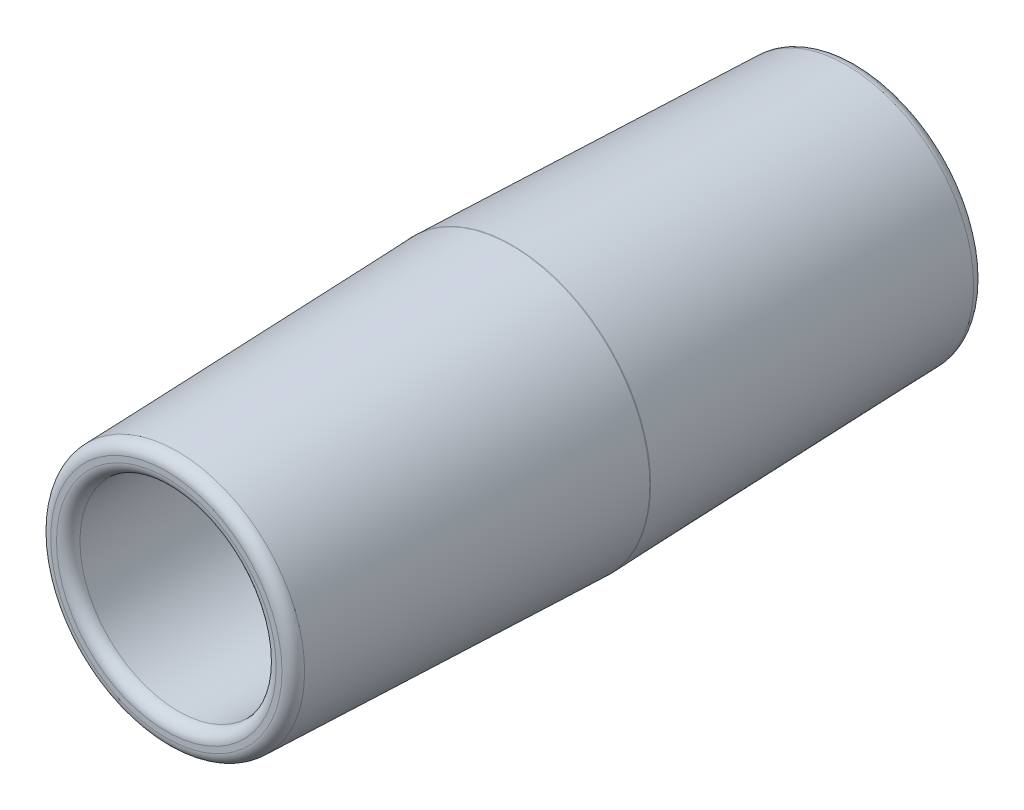
from build123d import *

# Parameters (mm, degrees)
FILLET3_R = 1
FILLET4_R = 1


with BuildPart() as part:
    # Sketch1 → Revolve1 (revolve)
    with BuildSketch(Plane(origin=(0, 0, 0), x_dir=(1, 0, 0), z_dir=(0, 1, 0)), mode=Mode.PRIVATE) as revolve1_sk:
        Polygon((8.5, 30), (9.5, 0), (8.5, -30), (11, -30), (12, 0), (11, 30), align=None)
    revolve(revolve1_sk.sketch.rotate(Axis((0, 0, -39.2734375), (0, 0, 1)), 180), axis=Axis((0, 0, -39.2734375), (0, 0, 1)))

    # Fillet3
    fillet3_edges = [part.edges().sort_by_distance(p)[0] for p in [
        (11, 0, -30),
        (12, 0, 0),
        (11, 0, 30),
        (8.5, 0, 30),
        (8.5, 0, -30),
    ]]
    fillet(fillet3_edges, radius=FILLET3_R)

    # Fillet4
    # the kernel refuses this fillet: 1 mm, written as the material it adds along each edge
    with BuildSketch(Plane(origin=(0, 0, 0), x_dir=(-1, 0, 0), z_dir=(0, 1, 0))) as fillet4_piece_1:
        with BuildLine():
            CenterArc((9.5 - FILLET4_R * 1.00055540132, 0), FILLET4_R, 358.090847567, 3.818304866)
            Line((9.5 - FILLET4_R * 0.00111049434109, FILLET4_R * 0.0333148302326), (9.5, 0))
            Line((9.5, 0), (9.5 - FILLET4_R * 0.00111049434109, -FILLET4_R * 0.0333148302326))
        make_face()
    revolve(axis=Axis((0, 0, 0), (0, 0, 1)))


solid = part.part
